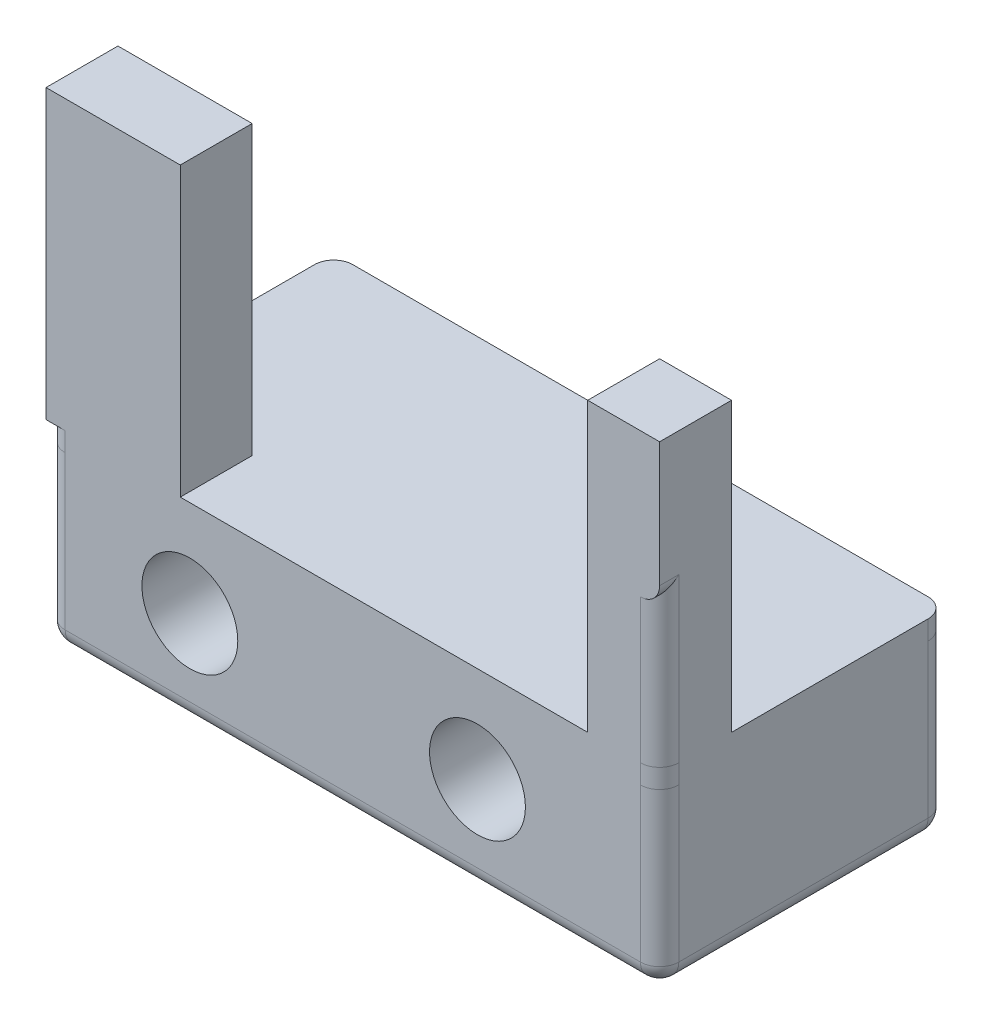
from build123d import *

# Parameters (mm, degrees)
EXTRUDE_1_DEPTH     = 30
SKETCH_2_R          = 5
CUT_EXTRUDE_1_DEPTH = 71
EXTRUDE_6_DEPTH     = 20
SKETCH_3_7_W        = 4.398
SKETCH_3_7_H        = 10.5
SKETCH_3_7_H_2      = 3.285510203
EXTRUDE_7_DEPTH     = 30
SKETCH_5_W          = 2.915886522
SKETCH_5_H          = 13.785510203
EXTRUDE_8_DEPTH     = 30
SKETCH_6_W          = 7.313886522
SKETCH_6_H          = 15
SKETCH_6_W_2        = 5
EXTRUDE_9_DEPTH     = 10
SKETCH_7_W          = 3.04
SKETCH_7_H          = 13
EXTRUDE_10_DEPTH    = 30
SKETCH_8_W          = 3.04
SKETCH_8_H          = 15
EXTRUDE_11_DEPTH    = 10
SKETCH_10_W         = 2.5
SKETCH_10_H         = 23
SKETCH_10_W_2       = 5.602
SKETCH_10_H_2       = 23.785510203
EXTRUDE_12_DEPTH    = 15
SKETCH_11_W         = 5.602
SKETCH_11_H         = 13.785510203
EXTRUDE_13_DEPTH    = 15
SKETCH_13_W         = 2.5
SKETCH_13_H         = 13
EXTRUDE_14_DEPTH    = 15
FILLET_1_R          = 2
SKETCH_14_W         = 4.252343595
SKETCH_14_H         = 32
CUT_EXTRUDE_2_DEPTH = 12
SKETCH_15_W         = 12
SKETCH_15_H         = 6.952343595
EXTRUDE_15_DEPTH    = 2
FILLET_2_R          = 2
CUT_EXTRUDE_3_DEPTH = 32
SKETCH_17_W         = 12.915886522
SKETCH_17_H         = 7.23748014
EXTRUDE_17_DEPTH    = 2
FILLET_3_R          = 2
SKETCH_20_W         = 10.54
SKETCH_20_H         = 0.8
CUT_EXTRUDE_4_DEPTH = 30
FILLET_5_R          = 2
SKETCH_21_W         = 10.244070675
SKETCH_21_H         = 15
CUT_EXTRUDE_5_DEPTH = 64
CUT_EXTRUDE_6_DEPTH = 64
SKETCH_23_W         = 64
SKETCH_23_H         = 30
EXTRUDE_18_DEPTH    = 2
FILLET_7_R          = 2
EXTRUDE_START       = 20
EXTRUDE_19_DEPTH    = 30


# Read off the part's stored shape, not the designer's step: 凸台-拉伸19
with BuildPart() as part:
    # 草图1 → 凸台-拉伸1 (new body)
    with BuildSketch(Plane.XY):
        Polygon((0, 20), (0, 0), (60, 0), (60, 20), (30, 20), align=None)
    extrude(amount=EXTRUDE_1_DEPTH)

    # 草图2 → 切除-拉伸1 (cut, through all)
    with BuildSketch(Plane.XY.offset(30)):
        with Locations((15, 10)):
            Circle(SKETCH_2_R)
        with Locations((45, 10)):
            Circle(SKETCH_2_R)
    extrude(amount=-CUT_EXTRUDE_1_DEPTH, mode=Mode.SUBTRACT)

    # 草图3 → 凸台-拉伸6 (add)
    with BuildSketch(Plane(origin=(0, 20, 0), x_dir=(1, 0, 0), z_dir=(0, 1, 0))):
        Polygon((60.96, -17), (60.96, -30), (64, -30), (64, 0), (60, 0), (60, -17), align=None)
        Polygon((60, -19.5), (60, -30), (60.96, -30), (60.96, -17), (60, -17), align=None)
    extrude(amount=-EXTRUDE_6_DEPTH)

    # 草图3<7> → 凸台-拉伸7 (add)
    with BuildSketch(Plane(origin=(0, 20, 0), x_dir=(1, 0, 0), z_dir=(0, 1, 0))):
        with Locations((7.801, -24.75)):
            Rectangle(SKETCH_3_7_W, SKETCH_3_7_H)
        with Locations((7.801, -17.857244898)):
            Rectangle(SKETCH_3_7_W, SKETCH_3_7_H_2)
        Polygon((60.96, -17), (60.96, -30), (55.96, -30), (55.96, -17), (58.46, -17), align=None)
    extrude(amount=EXTRUDE_7_DEPTH)

    # 草图5 → 凸台-拉伸8 (add)
    with BuildSketch(Plane(origin=(0, 20, 0), x_dir=(1, 0, 0), z_dir=(0, 1, 0))):
        with Locations((11.457943261, -23.107244899)):
            Rectangle(SKETCH_5_W, SKETCH_5_H)
    extrude(amount=EXTRUDE_8_DEPTH)

    # 草图6 → 凸台-拉伸9 (add)
    with BuildSketch(Plane.XY.offset(30)):
        with Locations((9.258943261, 42.5)):
            Rectangle(SKETCH_6_W, SKETCH_6_H)
        with Locations((58.46, 42.5)):
            Rectangle(SKETCH_6_W_2, SKETCH_6_H)
    extrude(amount=EXTRUDE_9_DEPTH)

    # 草图7 → 凸台-拉伸10 (add)
    with BuildSketch(Plane(origin=(0, 20, 0), x_dir=(1, 0, 0), z_dir=(0, 1, 0))):
        with Locations((62.48, -23.5)):
            Rectangle(SKETCH_7_W, SKETCH_7_H)
    extrude(amount=EXTRUDE_10_DEPTH)

    # 草图8 → 凸台-拉伸11 (add)
    with BuildSketch(Plane.XY.offset(30)):
        with Locations((62.48, 42.5)):
            Rectangle(SKETCH_8_W, SKETCH_8_H)
    extrude(amount=EXTRUDE_11_DEPTH)

    # 草图10 → 凸台-拉伸12 (add)
    with BuildSketch(Plane(origin=(0, 50, 0), x_dir=(1, 0, 0), z_dir=(0, 1, 0))):
        with Locations((54.71, -28.5)):
            Rectangle(SKETCH_10_W, SKETCH_10_H)
        with Locations((2.801, -28.107244898)):
            Rectangle(SKETCH_10_W_2, SKETCH_10_H_2)
    extrude(amount=-EXTRUDE_12_DEPTH)

    # 草图11 → 凸台-拉伸13 (add)
    with BuildSketch(Plane(origin=(0, 20, 0), x_dir=(1, 0, 0), z_dir=(0, 1, 0))):
        with Locations((2.801, -23.107244899)):
            Rectangle(SKETCH_11_W, SKETCH_11_H)
    extrude(amount=EXTRUDE_13_DEPTH)

    # 草图13 → 凸台-拉伸14 (add)
    with BuildSketch(Plane.XZ.offset(-35)):
        with Locations((54.71, 23.5)):
            Rectangle(SKETCH_13_W, SKETCH_13_H)
    extrude(amount=EXTRUDE_14_DEPTH)

    # 圆角1
    fillet_1_edges = [part.edges().sort_by_distance(p)[0] for p in [
        (64, 20, 8.5),
        (64, 35, 17),
        (64, 35, 35),
        (64, 42.5, 40),
        (53.46, 42.5, 40),
        (53.46, 35, 17),
        (0, 42.5, 40),
        (0, 35, 16.214489797),
        (0, 35, 35),
        (0, 20, 8.107244899),
        (53.46, 35, 35),
        (53.46, 27.5, 30),
        (0, 17.5, 30),
        (64, 0, 15),
        (64, 10, 0),
        (64, 17.5, 30),
        (0, 10, 0),
        (32, 0, 30),
        (32, 20, 0),
        (33.187943261, 20, 30),
        (12.915886522, 35, 16.214489797),
        (32, 0, 0),
        (12.915886522, 27.5, 30),
        (12.915886522, 35, 35),
        (12.915886522, 42.5, 40),
        (6.457943261, 50, 40),
        (6.457943261, 35, 40),
        (0, 0, 15),
        (58.73, 35, 40),
        (58.73, 50, 40),
    ]]
    fillet(fillet_1_edges, radius=FILLET_1_R)

    # 草图14 → 切除-拉伸2 (cut)
    with BuildSketch(Plane(origin=(64, 0, 0), x_dir=(0, 0, -1), z_dir=(1, 0, 0))):
        with Locations((-16.873828203, 34)):
            Rectangle(SKETCH_14_W, SKETCH_14_H)
        Polygon((-21.7, 50), (-21.7, 37), (-21.7, 18), (-19, 18), (-19, 50), align=None)
    extrude(amount=-CUT_EXTRUDE_2_DEPTH, mode=Mode.SUBTRACT)

    # 草图15 → 凸台-拉伸15 (add)
    with BuildSketch(Plane(origin=(0, 18, 0), x_dir=(1, 0, 0), z_dir=(0, 1, 0))):
        with Locations((58, -18.223828203)):
            Rectangle(SKETCH_15_W, SKETCH_15_H)
    extrude(amount=EXTRUDE_15_DEPTH)

    # 圆角2
    fillet_2_edges = [part.edges().sort_by_distance(p)[0] for p in [
        (64, 20, 18.223828202),
    ]]
    fillet(fillet_2_edges, radius=FILLET_2_R)

    # 草图16 → 切除-拉伸3 (cut)
    with BuildSketch(Plane(origin=(0, 50, 0), x_dir=(1, 0, 0), z_dir=(0, 1, 0))):
        with BuildLine():
            Line((0, -18.214489797), (0, -22.5))
            Line((0, -22.5), (12.915886522, -22.5))
            Line((12.915886522, -22.5), (12.915886522, -18.214489797))
            ThreePointArc((12.915886522, -18.214489797), (12.330100084, -16.800276235), (10.915886522, -16.214489797))
            Line((10.915886522, -16.214489797), (2, -16.214489797))
            ThreePointArc((2, -16.214489797), (0.585786438, -16.800276235), (0, -18.214489797))
        make_face()
        with BuildLine():
            Line((-1.657142537, -22.5), (0, -22.5))
            Line((0, -22.5), (0, -18.214489797))
            ThreePointArc((0, -18.214489797), (0.585786438, -16.800276235), (2, -16.214489797))
            Line((2, -16.214489797), (10.915886522, -16.214489797))
            ThreePointArc((10.915886522, -16.214489797), (12.330100084, -16.800276235), (12.915886522, -18.214489797))
            Line((12.915886522, -18.214489797), (12.915886522, -15.26251986))
            Line((12.915886522, -15.26251986), (-1.657142537, -15.26251986))
            Line((-1.657142537, -15.26251986), (-1.657142537, -22.5))
        make_face()
    extrude(amount=-CUT_EXTRUDE_3_DEPTH, mode=Mode.SUBTRACT)

    # 草图17 → 凸台-拉伸17 (add)
    with BuildSketch(Plane(origin=(0, 18, 0), x_dir=(1, 0, 0), z_dir=(0, 1, 0))):
        with Locations((6.457943261, -18.88125993)):
            Rectangle(SKETCH_17_W, SKETCH_17_H)
    extrude(amount=EXTRUDE_17_DEPTH)

    # 圆角3
    fillet_3_edges = [part.edges().sort_by_distance(p)[0] for p in [
        (0, 20, 18.88125993),
    ]]
    fillet(fillet_3_edges, radius=FILLET_3_R)

    # 草图20 → 切除-拉伸4 (cut)
    with BuildSketch(Plane(origin=(0, 50, 0), x_dir=(1, 0, 0), z_dir=(0, 1, 0))):
        with Locations((58.73, -22.1)):
            Rectangle(SKETCH_20_W, SKETCH_20_H)
    extrude(amount=-CUT_EXTRUDE_4_DEPTH, mode=Mode.SUBTRACT)

    # 圆角5
    fillet_5_edges = [part.edges().sort_by_distance(p)[0] for p in [
        (64, 20, 22.1),
    ]]
    fillet(fillet_5_edges, radius=FILLET_5_R - 0.0001)  # a hair under: the kernel refuses the full size

    # 草图21 → 切除-拉伸5 (cut)
    with BuildSketch(Plane.ZY):
        with Locations((35.122035338, 42.5)):
            Rectangle(SKETCH_21_W, SKETCH_21_H)
    extrude(amount=-CUT_EXTRUDE_5_DEPTH, mode=Mode.SUBTRACT)

    # 草图22 → 切除-拉伸6 (cut)
    with BuildSketch(Plane.XY.offset(30)):
        with BuildLine():
            Line((56.5, 20), (56.5, 37))
            Line((56.5, 37), (56.5, 50))
            Line((56.5, 50), (53.46, 50))
            Line((53.46, 50), (53.46, 37))
            ThreePointArc((53.46, 37), (54.045786438, 35.585786438), (55.46, 35))
            Line((55.46, 35), (55.46, 20))
            Line((55.46, 20), (56.5, 20))
        make_face()
        with BuildLine():
            Line((53.46, 20), (55.46, 20))
            Line((55.46, 20), (55.46, 35))
            ThreePointArc((55.46, 35), (54.045786438, 35.585786438), (53.46, 37))
            Line((53.46, 37), (53.46, 20))
        make_face()
    extrude(amount=-CUT_EXTRUDE_6_DEPTH, mode=Mode.SUBTRACT)

    # 草图23 → 凸台-拉伸18 (add)
    with BuildSketch(Plane(origin=(0, 20, 0), x_dir=(1, 0, 0), z_dir=(0, 1, 0))):
        with Locations((32, -15)):
            Rectangle(SKETCH_23_W, SKETCH_23_H)
    extrude(amount=-EXTRUDE_18_DEPTH)

    # 圆角7
    fillet_7_edges = [part.edges().sort_by_distance(p)[0] for p in [
        (0, 19, 0),
        (64, 19, 0),
        (64, 19, 30),
        (0, 19, 30),
    ]]
    fillet(fillet_7_edges, radius=FILLET_7_R)

    # 凸台-拉伸19 outline → 凸台-拉伸19 (add)
    with BuildSketch(Plane(origin=(0, 0, 0), x_dir=(1, 0, 0), z_dir=(0, 1, 0)).offset(EXTRUDE_START)):
        with BuildLine():
            Line((14, -30), (14, -22.5))
            Line((14, -22.5), (12.915886522, -22.5))
            Line((12.915886522, -22.5), (12.915886522, -28))
            ThreePointArc((12.915886522, -28), (12.330100084, -29.414213562), (10.915886522, -30))
            Line((10.915886522, -30), (14, -30))
        make_face()
        with BuildLine():
            ThreePointArc((2, -30), (0.585786438, -29.414213562), (0, -28))
            Line((0, -28), (0, -30))
            Line((0, -30), (2, -30))
        make_face()
    extrude(amount=EXTRUDE_19_DEPTH)


solid = part.part
